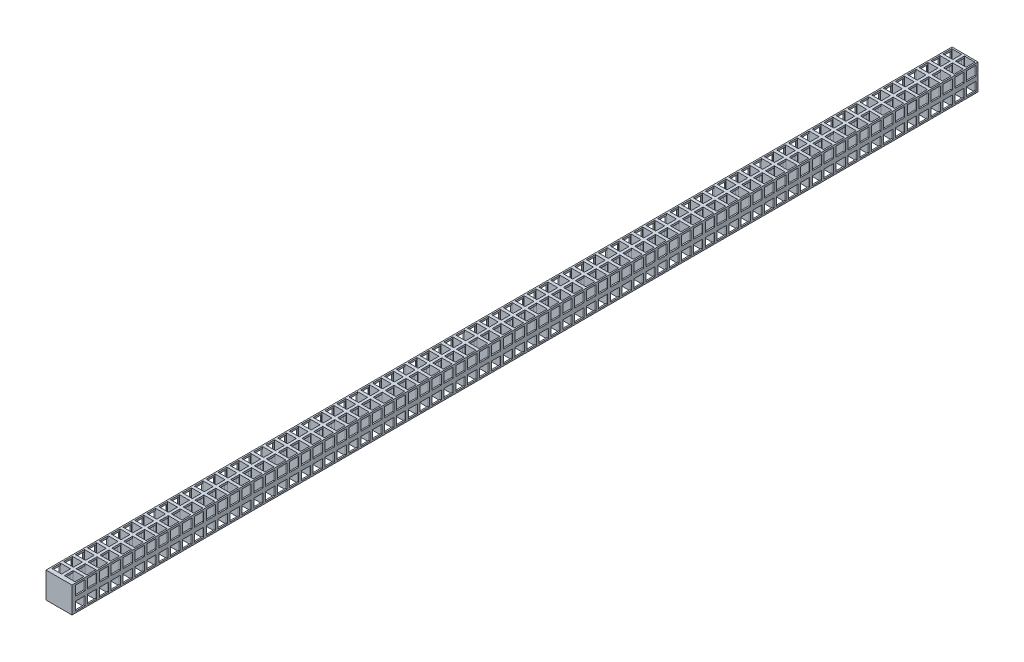
from build123d import *

# Parameters (mm, degrees)
CROQUIS1_W              = 350
CROQUIS1_H              = 350
SALIENTE_EXTRUIR1_DEPTH = 12200
CROQUIS2_W              = 132.983853674
CROQUIS2_H              = 119.94622096
CROQUIS2_W_2            = 143.413959844
CORTAR_EXTRUIR1_DEPTH   = 12200
MATRIZL1_COUNT          = 76
MATRIZL1_PITCH          = 160
CROQUIS3_W              = 124.906918139
CROQUIS3_H              = 128.691976265
CROQUIS3_H_2            = 117.336801889
CORTAR_EXTRUIR2_DEPTH   = 12200
MATRIZL2_COUNT          = 76
MATRIZL2_PITCH          = 160


with BuildPart() as part:
    # Croquis1 → Saliente-Extruir1 (new body)
    with BuildSketch(Plane.XY):
        Rectangle(CROQUIS1_W, CROQUIS1_H)
    extrude(amount=SALIENTE_EXTRUIR1_DEPTH)

    # Croquis2 → Cortar-Extruir1 (cut)
    with BuildSketch(Plane(origin=(0, 175, 0), x_dir=(1, 0, 0), z_dir=(0, 1, 0))):
        with Locations((-89.490629979, -81.655060457)):
            Rectangle(CROQUIS2_W, CROQUIS2_H)
        with Locations((85.213648377, -81.655060457)):
            Rectangle(CROQUIS2_W_2, CROQUIS2_H)
    cortar_extruir1 = extrude(amount=-CORTAR_EXTRUIR1_DEPTH, mode=Mode.SUBTRACT)

    # MatrizL1: Cortar-Extruir1 ×76
    with Locations(*[(0, 0, i * MATRIZL1_PITCH) for i in range(1, MATRIZL1_COUNT)]):
        add(cortar_extruir1, mode=Mode.SUBTRACT)

    # Croquis3 → Cortar-Extruir2 (cut)
    with BuildSketch(Plane(origin=(175, 0, 0), x_dir=(0, 0, -1), z_dir=(1, 0, 0))):
        with Locations((-89.150866182, 85.92052662)):
            Rectangle(CROQUIS3_W, CROQUIS3_H)
        with Locations((-89.150866182, -95.834670389)):
            Rectangle(CROQUIS3_W, CROQUIS3_H_2)
    cortar_extruir2 = extrude(amount=-CORTAR_EXTRUIR2_DEPTH, mode=Mode.SUBTRACT)

    # MatrizL2: Cortar-Extruir2 ×76
    with Locations(*[(0, 0, i * MATRIZL2_PITCH) for i in range(1, MATRIZL2_COUNT)]):
        add(cortar_extruir2, mode=Mode.SUBTRACT)


solid = part.part
